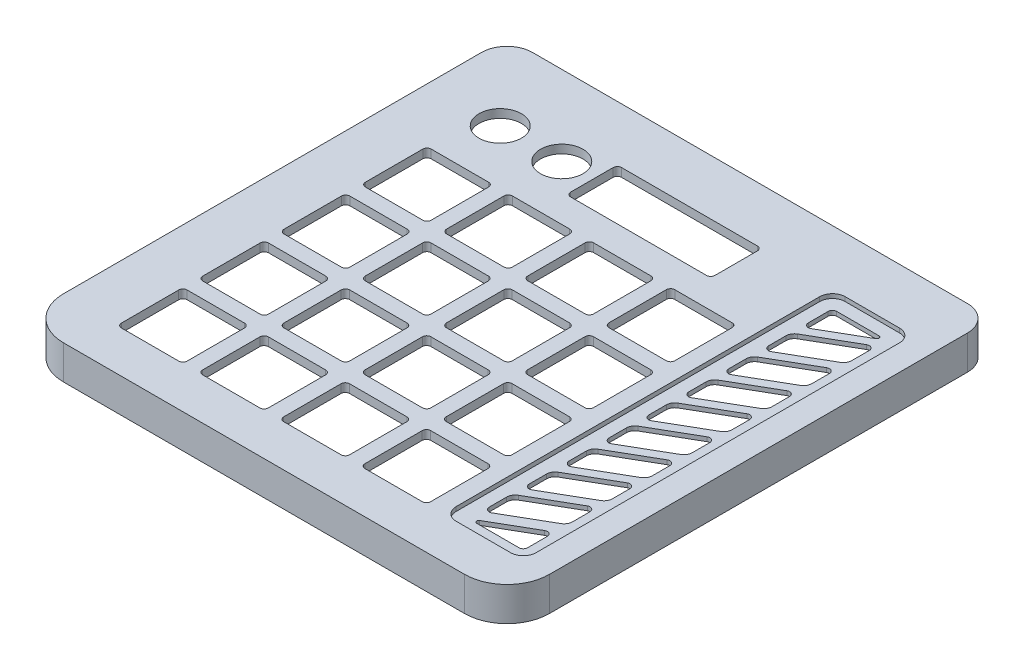
from build123d import *

# Parameters (mm, degrees)
BOSS_EXTRU_1_DEPTH      = 6
BOSS_EXTRU_2_DEPTH      = 2
ESQUISSE5_R             = 5
ENL_V_MAT_EXTRU_1_DEPTH = 33
ENL_V_MAT_EXTRU_2_DEPTH = 2
ENL_V_MAT_EXTRU_3_DEPTH = 1
ENL_V_MAT_EXTRU_5_DEPTH = 2


with BuildPart() as part:
    # Esquisse2 → Boss.-Extru.1 (new body)
    with BuildSketch(Plane(origin=(0, 0, 0), x_dir=(1, 0, 0), z_dir=(0, 1, 0))):
        with BuildLine():
            Line((8, -2), (102.5, -2))
            ThreePointArc((102.5, -2), (109.571067812, 0.928932188), (112.5, 8))
            Line((112.5, 8), (112.5, 106.5))
            ThreePointArc((112.5, 106.5), (110.742640687, 110.742640687), (106.5, 112.5))
            Line((106.5, 112.5), (4, 112.5))
            ThreePointArc((4, 112.5), (-0.242640687, 110.742640687), (-2, 106.5))
            Line((-2, 106.5), (-2, 8))
            ThreePointArc((-2, 8), (0.928932188, 0.928932188), (8, -2))
        make_face()
        with BuildLine():
            Line((8, 0), (102.5, 0))
            ThreePointArc((102.5, 0), (108.156854249, 2.343145751), (110.5, 8))
            Line((110.5, 8), (110.5, 106.5))
            ThreePointArc((110.5, 106.5), (109.328427125, 109.328427125), (106.5, 110.5))
            Line((106.5, 110.5), (4, 110.5))
            ThreePointArc((4, 110.5), (1.171572875, 109.328427125), (0, 106.5))
            Line((0, 106.5), (0, 8))
            ThreePointArc((0, 8), (2.343145751, 2.343145751), (8, 0))
        make_face(mode=Mode.SUBTRACT)
    extrude(amount=BOSS_EXTRU_1_DEPTH)

    # Esquisse3 → Boss.-Extru.2 (add)
    with BuildSketch(Plane(origin=(0, 6, 0), x_dir=(1, 0, 0), z_dir=(0, 1, 0))):
        with BuildLine():
            Line((4, 112.5), (106.5, 112.5))
            ThreePointArc((106.5, 112.5), (110.742640687, 110.742640687), (112.5, 106.5))
            Line((112.5, 106.5), (112.5, 8))
            ThreePointArc((112.5, 8), (109.571067812, 0.928932188), (102.5, -2))
            Line((102.5, -2), (8, -2))
            ThreePointArc((8, -2), (0.928932188, 0.928932188), (-2, 8))
            Line((-2, 8), (-2, 106.5))
            ThreePointArc((-2, 106.5), (-0.242640687, 110.742640687), (4, 112.5))
        make_face()
    extrude(amount=BOSS_EXTRU_2_DEPTH)

    # Esquisse5 → Enlèv. mat.-Extru.1 (cut)
    with BuildSketch(Plane(origin=(0, 8, 0), x_dir=(1, 0, 0), z_dir=(0, 1, 0))):
        with BuildLine():
            ThreePointArc((37, 88.5), (37.292893219, 87.792893219), (38, 87.5))
            Line((38, 87.5), (70, 87.5))
            ThreePointArc((70, 87.5), (70.707106781, 87.792893219), (71, 88.5))
            Line((71, 88.5), (71, 98.5))
            ThreePointArc((71, 98.5), (70.707106781, 99.207106781), (70, 99.5))
            Line((70, 99.5), (38, 99.5))
            ThreePointArc((38, 99.5), (37.292893219, 99.207106781), (37, 98.5))
            Line((37, 98.5), (37, 88.5))
        make_face()
        with BuildLine():
            Line((25.3, 80.848985119), (11.8, 80.848985119))
            ThreePointArc((11.8, 80.848985119), (11.092893219, 80.5560919), (10.8, 79.848985119))
            Line((10.8, 79.848985119), (10.8, 66.348985119))
            ThreePointArc((10.8, 66.348985119), (11.092893219, 65.641878337), (11.8, 65.348985119))
            Line((11.8, 65.348985119), (25.3, 65.348985119))
            ThreePointArc((25.3, 65.348985119), (26.007106781, 65.641878337), (26.3, 66.348985119))
            Line((26.3, 66.348985119), (26.3, 79.848985119))
            ThreePointArc((26.3, 79.848985119), (26.007106781, 80.5560919), (25.3, 80.848985119))
        make_face()
        with BuildLine():
            ThreePointArc((30.9262, 80.848985119), (30.219093219, 80.5560919), (29.9262, 79.848985119))
            Line((29.9262, 79.848985119), (29.9262, 66.348985119))
            ThreePointArc((29.9262, 66.348985119), (30.219093219, 65.641878337), (30.9262, 65.348985119))
            Line((30.9262, 65.348985119), (44.4262, 65.348985119))
            ThreePointArc((44.4262, 65.348985119), (45.133306781, 65.641878337), (45.4262, 66.348985119))
            Line((45.4262, 66.348985119), (45.4262, 79.848985119))
            ThreePointArc((45.4262, 79.848985119), (45.133306781, 80.5560919), (44.4262, 80.848985119))
            Line((44.4262, 80.848985119), (30.9262, 80.848985119))
        make_face()
        with BuildLine():
            ThreePointArc((50.0524, 80.848985119), (49.345293219, 80.5560919), (49.0524, 79.848985119))
            Line((49.0524, 79.848985119), (49.0524, 66.348985119))
            ThreePointArc((49.0524, 66.348985119), (49.345293219, 65.641878337), (50.0524, 65.348985119))
            Line((50.0524, 65.348985119), (63.5524, 65.348985119))
            ThreePointArc((63.5524, 65.348985119), (64.259506781, 65.641878337), (64.5524, 66.348985119))
            Line((64.5524, 66.348985119), (64.5524, 79.848985119))
            ThreePointArc((64.5524, 79.848985119), (64.259506781, 80.5560919), (63.5524, 80.848985119))
            Line((63.5524, 80.848985119), (50.0524, 80.848985119))
        make_face()
        with BuildLine():
            ThreePointArc((69.1786, 80.848985119), (68.471493219, 80.5560919), (68.1786, 79.848985119))
            Line((68.1786, 79.848985119), (68.1786, 66.348985119))
            ThreePointArc((68.1786, 66.348985119), (68.471493219, 65.641878337), (69.1786, 65.348985119))
            Line((69.1786, 65.348985119), (82.6786, 65.348985119))
            ThreePointArc((82.6786, 65.348985119), (83.385706781, 65.641878337), (83.6786, 66.348985119))
            Line((83.6786, 66.348985119), (83.6786, 79.848985119))
            ThreePointArc((83.6786, 79.848985119), (83.385706781, 80.5560919), (82.6786, 80.848985119))
            Line((82.6786, 80.848985119), (69.1786, 80.848985119))
        make_face()
        with BuildLine():
            ThreePointArc((30.9262, 61.681485119), (30.219093219, 61.3885919), (29.9262, 60.681485119))
            Line((29.9262, 60.681485119), (29.9262, 47.181485119))
            ThreePointArc((29.9262, 47.181485119), (30.219093219, 46.474378337), (30.9262, 46.181485119))
            Line((30.9262, 46.181485119), (44.4262, 46.181485119))
            ThreePointArc((44.4262, 46.181485119), (45.133306781, 46.474378337), (45.4262, 47.181485119))
            Line((45.4262, 47.181485119), (45.4262, 60.681485119))
            ThreePointArc((45.4262, 60.681485119), (45.133306781, 61.3885919), (44.4262, 61.681485119))
            Line((44.4262, 61.681485119), (30.9262, 61.681485119))
        make_face()
        with BuildLine():
            ThreePointArc((50.0524, 61.681485119), (49.345293219, 61.3885919), (49.0524, 60.681485119))
            Line((49.0524, 60.681485119), (49.0524, 47.181485119))
            ThreePointArc((49.0524, 47.181485119), (49.345293219, 46.474378337), (50.0524, 46.181485119))
            Line((50.0524, 46.181485119), (63.5524, 46.181485119))
            ThreePointArc((63.5524, 46.181485119), (64.259506781, 46.474378337), (64.5524, 47.181485119))
            Line((64.5524, 47.181485119), (64.5524, 60.681485119))
            ThreePointArc((64.5524, 60.681485119), (64.259506781, 61.3885919), (63.5524, 61.681485119))
            Line((63.5524, 61.681485119), (50.0524, 61.681485119))
        make_face()
        with BuildLine():
            ThreePointArc((69.1786, 61.681485119), (68.471493219, 61.3885919), (68.1786, 60.681485119))
            Line((68.1786, 60.681485119), (68.1786, 47.181485119))
            ThreePointArc((68.1786, 47.181485119), (68.471493219, 46.474378337), (69.1786, 46.181485119))
            Line((69.1786, 46.181485119), (82.6786, 46.181485119))
            ThreePointArc((82.6786, 46.181485119), (83.385706781, 46.474378337), (83.6786, 47.181485119))
            Line((83.6786, 47.181485119), (83.6786, 60.681485119))
            ThreePointArc((83.6786, 60.681485119), (83.385706781, 61.3885919), (82.6786, 61.681485119))
            Line((82.6786, 61.681485119), (69.1786, 61.681485119))
        make_face()
        with BuildLine():
            ThreePointArc((30.9262, 42.513985119), (30.219093219, 42.2210919), (29.9262, 41.513985119))
            Line((29.9262, 41.513985119), (29.9262, 28.013985119))
            ThreePointArc((29.9262, 28.013985119), (30.219093219, 27.306878337), (30.9262, 27.013985119))
            Line((30.9262, 27.013985119), (44.4262, 27.013985119))
            ThreePointArc((44.4262, 27.013985119), (45.133306781, 27.306878337), (45.4262, 28.013985119))
            Line((45.4262, 28.013985119), (45.4262, 41.513985119))
            ThreePointArc((45.4262, 41.513985119), (45.133306781, 42.2210919), (44.4262, 42.513985119))
            Line((44.4262, 42.513985119), (30.9262, 42.513985119))
        make_face()
        with BuildLine():
            ThreePointArc((50.0524, 42.513985119), (49.345293219, 42.2210919), (49.0524, 41.513985119))
            Line((49.0524, 41.513985119), (49.0524, 28.013985119))
            ThreePointArc((49.0524, 28.013985119), (49.345293219, 27.306878337), (50.0524, 27.013985119))
            Line((50.0524, 27.013985119), (63.5524, 27.013985119))
            ThreePointArc((63.5524, 27.013985119), (64.259506781, 27.306878337), (64.5524, 28.013985119))
            Line((64.5524, 28.013985119), (64.5524, 41.513985119))
            ThreePointArc((64.5524, 41.513985119), (64.259506781, 42.2210919), (63.5524, 42.513985119))
            Line((63.5524, 42.513985119), (50.0524, 42.513985119))
        make_face()
        with BuildLine():
            ThreePointArc((69.1786, 42.513985119), (68.471493219, 42.2210919), (68.1786, 41.513985119))
            Line((68.1786, 41.513985119), (68.1786, 28.013985119))
            ThreePointArc((68.1786, 28.013985119), (68.471493219, 27.306878337), (69.1786, 27.013985119))
            Line((69.1786, 27.013985119), (82.6786, 27.013985119))
            ThreePointArc((82.6786, 27.013985119), (83.385706781, 27.306878337), (83.6786, 28.013985119))
            Line((83.6786, 28.013985119), (83.6786, 41.513985119))
            ThreePointArc((83.6786, 41.513985119), (83.385706781, 42.2210919), (82.6786, 42.513985119))
            Line((82.6786, 42.513985119), (69.1786, 42.513985119))
        make_face()
        with BuildLine():
            ThreePointArc((30.9262, 23.346485119), (30.219093219, 23.0535919), (29.9262, 22.346485119))
            Line((29.9262, 22.346485119), (29.9262, 8.846485119))
            ThreePointArc((29.9262, 8.846485119), (30.219093219, 8.139378337), (30.9262, 7.846485119))
            Line((30.9262, 7.846485119), (44.4262, 7.846485119))
            ThreePointArc((44.4262, 7.846485119), (45.133306781, 8.139378337), (45.4262, 8.846485119))
            Line((45.4262, 8.846485119), (45.4262, 22.346485119))
            ThreePointArc((45.4262, 22.346485119), (45.133306781, 23.0535919), (44.4262, 23.346485119))
            Line((44.4262, 23.346485119), (30.9262, 23.346485119))
        make_face()
        with BuildLine():
            ThreePointArc((50.0524, 23.346485119), (49.345293219, 23.0535919), (49.0524, 22.346485119))
            Line((49.0524, 22.346485119), (49.0524, 8.846485119))
            ThreePointArc((49.0524, 8.846485119), (49.345293219, 8.139378337), (50.0524, 7.846485119))
            Line((50.0524, 7.846485119), (63.5524, 7.846485119))
            ThreePointArc((63.5524, 7.846485119), (64.259506781, 8.139378337), (64.5524, 8.846485119))
            Line((64.5524, 8.846485119), (64.5524, 22.346485119))
            ThreePointArc((64.5524, 22.346485119), (64.259506781, 23.0535919), (63.5524, 23.346485119))
            Line((63.5524, 23.346485119), (50.0524, 23.346485119))
        make_face()
        with BuildLine():
            ThreePointArc((69.1786, 23.346485119), (68.471493219, 23.0535919), (68.1786, 22.346485119))
            Line((68.1786, 22.346485119), (68.1786, 8.846485119))
            ThreePointArc((68.1786, 8.846485119), (68.471493219, 8.139378337), (69.1786, 7.846485119))
            Line((69.1786, 7.846485119), (82.6786, 7.846485119))
            ThreePointArc((82.6786, 7.846485119), (83.385706781, 8.139378337), (83.6786, 8.846485119))
            Line((83.6786, 8.846485119), (83.6786, 22.346485119))
            ThreePointArc((83.6786, 22.346485119), (83.385706781, 23.0535919), (82.6786, 23.346485119))
            Line((82.6786, 23.346485119), (69.1786, 23.346485119))
        make_face()
        with BuildLine():
            ThreePointArc((11.8, 61.681485119), (11.092893219, 61.3885919), (10.8, 60.681485119))
            Line((10.8, 60.681485119), (10.8, 47.181485119))
            ThreePointArc((10.8, 47.181485119), (11.092893219, 46.474378337), (11.8, 46.181485119))
            Line((11.8, 46.181485119), (25.3, 46.181485119))
            ThreePointArc((25.3, 46.181485119), (26.007106781, 46.474378337), (26.3, 47.181485119))
            Line((26.3, 47.181485119), (26.3, 60.681485119))
            ThreePointArc((26.3, 60.681485119), (26.007106781, 61.3885919), (25.3, 61.681485119))
            Line((25.3, 61.681485119), (11.8, 61.681485119))
        make_face()
        with BuildLine():
            ThreePointArc((11.8, 42.513985119), (11.092893219, 42.2210919), (10.8, 41.513985119))
            Line((10.8, 41.513985119), (10.8, 28.013985119))
            ThreePointArc((10.8, 28.013985119), (11.092893219, 27.306878337), (11.8, 27.013985119))
            Line((11.8, 27.013985119), (25.3, 27.013985119))
            ThreePointArc((25.3, 27.013985119), (26.007106781, 27.306878337), (26.3, 28.013985119))
            Line((26.3, 28.013985119), (26.3, 41.513985119))
            ThreePointArc((26.3, 41.513985119), (26.007106781, 42.2210919), (25.3, 42.513985119))
            Line((25.3, 42.513985119), (11.8, 42.513985119))
        make_face()
        with BuildLine():
            ThreePointArc((11.8, 23.346485119), (11.092893219, 23.0535919), (10.8, 22.346485119))
            Line((10.8, 22.346485119), (10.8, 8.846485119))
            ThreePointArc((10.8, 8.846485119), (11.092893219, 8.139378337), (11.8, 7.846485119))
            Line((11.8, 7.846485119), (25.3, 7.846485119))
            ThreePointArc((25.3, 7.846485119), (26.007106781, 8.139378337), (26.3, 8.846485119))
            Line((26.3, 8.846485119), (26.3, 22.346485119))
            ThreePointArc((26.3, 22.346485119), (26.007106781, 23.0535919), (25.3, 23.346485119))
            Line((25.3, 23.346485119), (11.8, 23.346485119))
        make_face()
        with Locations((29.7, 93.7)):
            Circle(ESQUISSE5_R)
        with Locations((15.2, 93.7)):
            Circle(ESQUISSE5_R)
    extrude(amount=-ENL_V_MAT_EXTRU_1_DEPTH, mode=Mode.SUBTRACT)

    # Esquisse6 → Enlèv. mat.-Extru.2 (cut)
    with BuildSketch(Plane(origin=(0, 8, 0), x_dir=(1, 0, 0), z_dir=(0, 1, 0))):
        with BuildLine():
            Line((102, 93.233974596), (91.6786, 87.274911528))
            ThreePointArc((91.6786, 87.274911528), (90.946549192, 86.54286072), (90.6786, 85.54286072))
            Line((90.6786, 85.54286072), (90.6786, 81.429612066))
            ThreePointArc((90.6786, 81.429612066), (91.1786, 80.563586662), (92.1786, 80.563586662))
            Line((92.1786, 80.563586662), (102.5, 86.522649731))
            ThreePointArc((102.5, 86.522649731), (103.232050808, 87.254700538), (103.5, 88.254700538))
            Line((103.5, 88.254700538), (103.5, 92.367949192))
            ThreePointArc((103.5, 92.367949192), (103, 93.233974596), (102, 93.233974596))
        make_face()
        with BuildLine():
            ThreePointArc((91.6786, 96.5), (90.971493219, 96.207106781), (90.6786, 95.5))
            Line((90.6786, 95.5), (90.6786, 90.829612066))
            ThreePointArc((90.6786, 90.829612066), (91.1786, 89.963586662), (92.1786, 89.963586662))
            Line((92.1786, 89.963586662), (101.883974596, 95.566987298))
            ThreePointArc((101.883974596, 95.566987298), (102.116937509, 96.129409523), (101.633974596, 96.5))
            Line((101.633974596, 96.5), (91.6786, 96.5))
        make_face()
        with BuildLine():
            Line((92.544625404, 10.846485119), (102.5, 10.846485119))
            ThreePointArc((102.5, 10.846485119), (103.207106781, 11.139378337), (103.5, 11.846485119))
            Line((103.5, 11.846485119), (103.5, 16.516873052))
            ThreePointArc((103.5, 16.516873052), (103, 17.382898456), (102, 17.382898456))
            Line((102, 17.382898456), (92.294625404, 11.77949782))
            ThreePointArc((92.294625404, 11.77949782), (92.061662491, 11.217075596), (92.544625404, 10.846485119))
        make_face()
        with BuildLine():
            Line((90.6786, 76.14286072), (90.6786, 72.029612066))
            ThreePointArc((90.6786, 72.029612066), (91.1786, 71.163586662), (92.1786, 71.163586662))
            Line((92.1786, 71.163586662), (102.5, 77.122649731))
            ThreePointArc((102.5, 77.122649731), (103.232050808, 77.854700538), (103.5, 78.854700538))
            Line((103.5, 78.854700538), (103.5, 82.967949192))
            ThreePointArc((103.5, 82.967949192), (103, 83.833974596), (102, 83.833974596))
            Line((102, 83.833974596), (91.6786, 77.874911528))
            ThreePointArc((91.6786, 77.874911528), (90.946549192, 77.14286072), (90.6786, 76.14286072))
        make_face()
        with BuildLine():
            Line((90.6786, 66.74286072), (90.6786, 62.629612066))
            ThreePointArc((90.6786, 62.629612066), (91.1786, 61.763586662), (92.1786, 61.763586662))
            Line((92.1786, 61.763586662), (102.5, 67.722649731))
            ThreePointArc((102.5, 67.722649731), (103.232050808, 68.454700538), (103.5, 69.454700538))
            Line((103.5, 69.454700538), (103.5, 73.567949192))
            ThreePointArc((103.5, 73.567949192), (103, 74.433974596), (102, 74.433974596))
            Line((102, 74.433974596), (91.6786, 68.474911528))
            ThreePointArc((91.6786, 68.474911528), (90.946549192, 67.74286072), (90.6786, 66.74286072))
        make_face()
        with BuildLine():
            Line((90.6786, 57.34286072), (90.6786, 53.229612066))
            ThreePointArc((90.6786, 53.229612066), (91.1786, 52.363586662), (92.1786, 52.363586662))
            Line((92.1786, 52.363586662), (102.5, 58.322649731))
            ThreePointArc((102.5, 58.322649731), (103.232050808, 59.054700538), (103.5, 60.054700538))
            Line((103.5, 60.054700538), (103.5, 64.167949192))
            ThreePointArc((103.5, 64.167949192), (103, 65.033974596), (102, 65.033974596))
            Line((102, 65.033974596), (91.6786, 59.074911528))
            ThreePointArc((91.6786, 59.074911528), (90.946549192, 58.34286072), (90.6786, 57.34286072))
        make_face()
        with BuildLine():
            Line((90.6786, 47.94286072), (90.6786, 43.829612066))
            ThreePointArc((90.6786, 43.829612066), (91.1786, 42.963586662), (92.1786, 42.963586662))
            Line((92.1786, 42.963586662), (102.5, 48.922649731))
            ThreePointArc((102.5, 48.922649731), (103.232050808, 49.654700538), (103.5, 50.654700538))
            Line((103.5, 50.654700538), (103.5, 54.767949192))
            ThreePointArc((103.5, 54.767949192), (103, 55.633974596), (102, 55.633974596))
            Line((102, 55.633974596), (91.6786, 49.674911528))
            ThreePointArc((91.6786, 49.674911528), (90.946549192, 48.94286072), (90.6786, 47.94286072))
        make_face()
        with BuildLine():
            Line((90.6786, 38.54286072), (90.6786, 34.429612066))
            ThreePointArc((90.6786, 34.429612066), (91.1786, 33.563586662), (92.1786, 33.563586662))
            Line((92.1786, 33.563586662), (102.5, 39.522649731))
            ThreePointArc((102.5, 39.522649731), (103.232050808, 40.254700538), (103.5, 41.254700538))
            Line((103.5, 41.254700538), (103.5, 45.367949192))
            ThreePointArc((103.5, 45.367949192), (103, 46.233974596), (102, 46.233974596))
            Line((102, 46.233974596), (91.6786, 40.274911528))
            ThreePointArc((91.6786, 40.274911528), (90.946549192, 39.54286072), (90.6786, 38.54286072))
        make_face()
        with BuildLine():
            Line((90.6786, 29.14286072), (90.6786, 25.029612066))
            ThreePointArc((90.6786, 25.029612066), (91.1786, 24.163586662), (92.1786, 24.163586662))
            Line((92.1786, 24.163586662), (102.5, 30.122649731))
            ThreePointArc((102.5, 30.122649731), (103.232050808, 30.854700538), (103.5, 31.854700538))
            Line((103.5, 31.854700538), (103.5, 35.967949192))
            ThreePointArc((103.5, 35.967949192), (103, 36.833974596), (102, 36.833974596))
            Line((102, 36.833974596), (91.6786, 30.874911528))
            ThreePointArc((91.6786, 30.874911528), (90.946549192, 30.14286072), (90.6786, 29.14286072))
        make_face()
        with BuildLine():
            Line((90.6786, 19.74286072), (90.6786, 15.629612066))
            ThreePointArc((90.6786, 15.629612066), (91.1786, 14.763586662), (92.1786, 14.763586662))
            Line((92.1786, 14.763586662), (102.5, 20.722649731))
            ThreePointArc((102.5, 20.722649731), (103.232050808, 21.454700538), (103.5, 22.454700538))
            Line((103.5, 22.454700538), (103.5, 26.567949192))
            ThreePointArc((103.5, 26.567949192), (103, 27.433974596), (102, 27.433974596))
            Line((102, 27.433974596), (91.6786, 21.474911528))
            ThreePointArc((91.6786, 21.474911528), (90.946549192, 20.74286072), (90.6786, 19.74286072))
        make_face()
    extrude(amount=-ENL_V_MAT_EXTRU_2_DEPTH, mode=Mode.SUBTRACT)

    # Esquisse6<3> → Enlèv. mat.-Extru.3 (cut)
    with BuildSketch(Plane(origin=(0, 8, 0), x_dir=(1, 0, 0), z_dir=(0, 1, 0))):
        with BuildLine():
            Line((90.6786, 99.5), (103.5, 99.5))
            ThreePointArc((103.5, 99.5), (105.621320344, 98.621320344), (106.5, 96.5))
            Line((106.5, 96.5), (106.5, 10.846485119))
            ThreePointArc((106.5, 10.846485119), (105.621320344, 8.725164775), (103.5, 7.846485119))
            Line((103.5, 7.846485119), (90.6786, 7.846485119))
            ThreePointArc((90.6786, 7.846485119), (88.557279656, 8.725164775), (87.6786, 10.846485119))
            Line((87.6786, 10.846485119), (87.6786, 96.5))
            ThreePointArc((87.6786, 96.5), (88.557279656, 98.621320344), (90.6786, 99.5))
        make_face()
        with BuildLine():
            Line((91.6786, 87.274911528), (102, 93.233974596))
            ThreePointArc((102, 93.233974596), (103, 93.233974596), (103.5, 92.367949192))
            Line((103.5, 92.367949192), (103.5, 88.254700538))
            ThreePointArc((103.5, 88.254700538), (103.232050808, 87.254700538), (102.5, 86.522649731))
            Line((102.5, 86.522649731), (92.1786, 80.563586662))
            ThreePointArc((92.1786, 80.563586662), (91.1786, 80.563586662), (90.6786, 81.429612066))
            Line((90.6786, 81.429612066), (90.6786, 85.54286072))
            ThreePointArc((90.6786, 85.54286072), (90.946549192, 86.54286072), (91.6786, 87.274911528))
        make_face(mode=Mode.SUBTRACT)
        with BuildLine():
            Line((90.6786, 95.5), (90.6786, 90.829612066))
            ThreePointArc((90.6786, 90.829612066), (91.1786, 89.963586662), (92.1786, 89.963586662))
            Line((92.1786, 89.963586662), (101.883974596, 95.566987298))
            ThreePointArc((101.883974596, 95.566987298), (102.116937509, 96.129409523), (101.633974596, 96.5))
            Line((101.633974596, 96.5), (91.6786, 96.5))
            ThreePointArc((91.6786, 96.5), (90.971493219, 96.207106781), (90.6786, 95.5))
        make_face(mode=Mode.SUBTRACT)
        with BuildLine():
            Line((102.5, 10.846485119), (92.544625404, 10.846485119))
            ThreePointArc((92.544625404, 10.846485119), (92.061662491, 11.217075596), (92.294625404, 11.77949782))
            Line((92.294625404, 11.77949782), (102, 17.382898456))
            ThreePointArc((102, 17.382898456), (103, 17.382898456), (103.5, 16.516873052))
            Line((103.5, 16.516873052), (103.5, 11.846485119))
            ThreePointArc((103.5, 11.846485119), (103.207106781, 11.139378337), (102.5, 10.846485119))
        make_face(mode=Mode.SUBTRACT)
        with BuildLine():
            Line((90.6786, 72.029612066), (90.6786, 76.14286072))
            ThreePointArc((90.6786, 76.14286072), (90.946549192, 77.14286072), (91.6786, 77.874911528))
            Line((91.6786, 77.874911528), (102, 83.833974596))
            ThreePointArc((102, 83.833974596), (103, 83.833974596), (103.5, 82.967949192))
            Line((103.5, 82.967949192), (103.5, 78.854700538))
            ThreePointArc((103.5, 78.854700538), (103.232050808, 77.854700538), (102.5, 77.122649731))
            Line((102.5, 77.122649731), (92.1786, 71.163586662))
            ThreePointArc((92.1786, 71.163586662), (91.1786, 71.163586662), (90.6786, 72.029612066))
        make_face(mode=Mode.SUBTRACT)
        with BuildLine():
            Line((90.6786, 62.629612066), (90.6786, 66.74286072))
            ThreePointArc((90.6786, 66.74286072), (90.946549192, 67.74286072), (91.6786, 68.474911528))
            Line((91.6786, 68.474911528), (102, 74.433974596))
            ThreePointArc((102, 74.433974596), (103, 74.433974596), (103.5, 73.567949192))
            Line((103.5, 73.567949192), (103.5, 69.454700538))
            ThreePointArc((103.5, 69.454700538), (103.232050808, 68.454700538), (102.5, 67.722649731))
            Line((102.5, 67.722649731), (92.1786, 61.763586662))
            ThreePointArc((92.1786, 61.763586662), (91.1786, 61.763586662), (90.6786, 62.629612066))
        make_face(mode=Mode.SUBTRACT)
        with BuildLine():
            Line((90.6786, 53.229612066), (90.6786, 57.34286072))
            ThreePointArc((90.6786, 57.34286072), (90.946549192, 58.34286072), (91.6786, 59.074911528))
            Line((91.6786, 59.074911528), (102, 65.033974596))
            ThreePointArc((102, 65.033974596), (103, 65.033974596), (103.5, 64.167949192))
            Line((103.5, 64.167949192), (103.5, 60.054700538))
            ThreePointArc((103.5, 60.054700538), (103.232050808, 59.054700538), (102.5, 58.322649731))
            Line((102.5, 58.322649731), (92.1786, 52.363586662))
            ThreePointArc((92.1786, 52.363586662), (91.1786, 52.363586662), (90.6786, 53.229612066))
        make_face(mode=Mode.SUBTRACT)
        with BuildLine():
            Line((90.6786, 43.829612066), (90.6786, 47.94286072))
            ThreePointArc((90.6786, 47.94286072), (90.946549192, 48.94286072), (91.6786, 49.674911528))
            Line((91.6786, 49.674911528), (102, 55.633974596))
            ThreePointArc((102, 55.633974596), (103, 55.633974596), (103.5, 54.767949192))
            Line((103.5, 54.767949192), (103.5, 50.654700538))
            ThreePointArc((103.5, 50.654700538), (103.232050808, 49.654700538), (102.5, 48.922649731))
            Line((102.5, 48.922649731), (92.1786, 42.963586662))
            ThreePointArc((92.1786, 42.963586662), (91.1786, 42.963586662), (90.6786, 43.829612066))
        make_face(mode=Mode.SUBTRACT)
        with BuildLine():
            Line((90.6786, 34.429612066), (90.6786, 38.54286072))
            ThreePointArc((90.6786, 38.54286072), (90.946549192, 39.54286072), (91.6786, 40.274911528))
            Line((91.6786, 40.274911528), (102, 46.233974596))
            ThreePointArc((102, 46.233974596), (103, 46.233974596), (103.5, 45.367949192))
            Line((103.5, 45.367949192), (103.5, 41.254700538))
            ThreePointArc((103.5, 41.254700538), (103.232050808, 40.254700538), (102.5, 39.522649731))
            Line((102.5, 39.522649731), (92.1786, 33.563586662))
            ThreePointArc((92.1786, 33.563586662), (91.1786, 33.563586662), (90.6786, 34.429612066))
        make_face(mode=Mode.SUBTRACT)
        with BuildLine():
            Line((90.6786, 25.029612066), (90.6786, 29.14286072))
            ThreePointArc((90.6786, 29.14286072), (90.946549192, 30.14286072), (91.6786, 30.874911528))
            Line((91.6786, 30.874911528), (102, 36.833974596))
            ThreePointArc((102, 36.833974596), (103, 36.833974596), (103.5, 35.967949192))
            Line((103.5, 35.967949192), (103.5, 31.854700538))
            ThreePointArc((103.5, 31.854700538), (103.232050808, 30.854700538), (102.5, 30.122649731))
            Line((102.5, 30.122649731), (92.1786, 24.163586662))
            ThreePointArc((92.1786, 24.163586662), (91.1786, 24.163586662), (90.6786, 25.029612066))
        make_face(mode=Mode.SUBTRACT)
        with BuildLine():
            Line((90.6786, 15.629612066), (90.6786, 19.74286072))
            ThreePointArc((90.6786, 19.74286072), (90.946549192, 20.74286072), (91.6786, 21.474911528))
            Line((91.6786, 21.474911528), (102, 27.433974596))
            ThreePointArc((102, 27.433974596), (103, 27.433974596), (103.5, 26.567949192))
            Line((103.5, 26.567949192), (103.5, 22.454700538))
            ThreePointArc((103.5, 22.454700538), (103.232050808, 21.454700538), (102.5, 20.722649731))
            Line((102.5, 20.722649731), (92.1786, 14.763586662))
            ThreePointArc((92.1786, 14.763586662), (91.1786, 14.763586662), (90.6786, 15.629612066))
        make_face(mode=Mode.SUBTRACT)
    extrude(amount=-ENL_V_MAT_EXTRU_3_DEPTH, mode=Mode.SUBTRACT)

    # Esquisse10 → Enlèv. mat.-Extru.5 (cut)
    with BuildSketch(Plane(origin=(0, 0, -112.5), x_dir=(-1, 0, 0), z_dir=(0, 0, -1))):
        with BuildLine():
            Line((-99.75, 0), (-83.75, 0))
            Line((-83.75, 0), (-83.75, 2))
            ThreePointArc((-83.75, 2), (-84.335786438, 3.414213562), (-85.75, 4))
            Line((-85.75, 4), (-97.75, 4))
            ThreePointArc((-97.75, 4), (-99.164213562, 3.414213562), (-99.75, 2))
            Line((-99.75, 2), (-99.75, 0))
        make_face()
    extrude(amount=-ENL_V_MAT_EXTRU_5_DEPTH, mode=Mode.SUBTRACT)


solid = part.part
